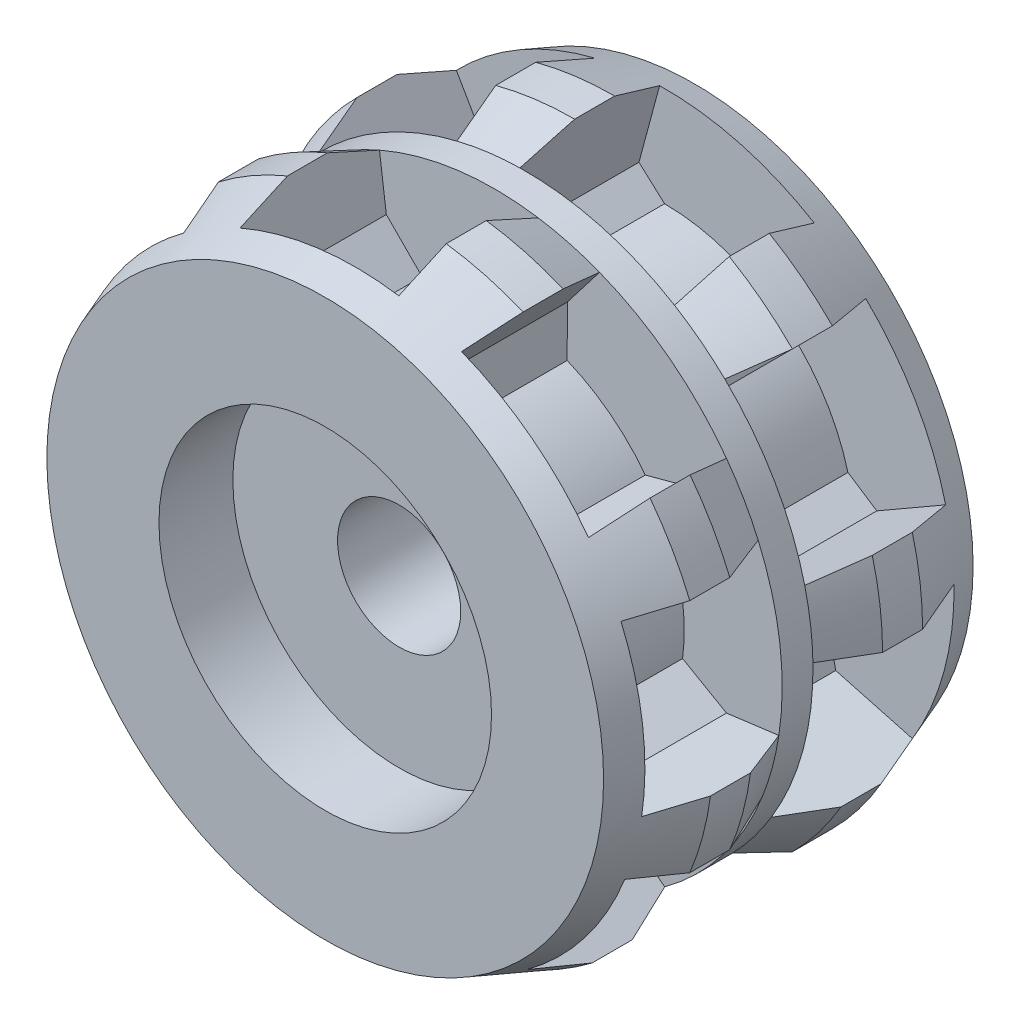
from build123d import *
from OCP.BRepFilletAPI import BRepFilletAPI_MakeChamfer

# Parameters (mm, degrees)
SKETCH1_R       = 23.35
EXTRUDE1_DEPTH  = 2.5
EXTRUDE2_REACH  = 92.111
SKETCH2_R       = 5
SKETCH3_R       = 25
SKETCH3_R_2     = 5
EXTRUDE3_DEPTH  = 13.75
EXTRUDE4_START  = 13.75
SKETCH4_R       = 25
SKETCH4_R_2     = 5
EXTRUDE4_DEPTH  = 13.75
CHAMFER1_SIZE   = 1.65
CHAMFER1_SIZE_2 = 4
CHAMFER2_SIZE   = 6.5
CHAMFER2_SIZE2  = 2.4
EXTRUDE5_DEPTH  = 11.3
EXTRUDE6_START  = 11.3
EXTRUDE6_DEPTH  = 11.3
SKETCH9_R       = 13.5
SKETCH9_R_2     = 9.75
EXTRUDE7_DEPTH  = 6
EXTRUDE8_START  = -6
SKETCH10_R      = 13.5
SKETCH10_R_2    = 9.75
EXTRUDE8_DEPTH  = 6
SKETCH11_R      = 9.75
EXTRUDE9_DEPTH  = 6


with BuildPart() as part:
    # Sketch1 → Extrude1 (new body)
    with BuildSketch(Plane.XY):
        with Locations((-57.424544578, 16.515488854)):
            Circle(SKETCH1_R)
    extrude(amount=EXTRUDE1_DEPTH)

    # Sketch2 → Extrude2 (cut, up to next)
    with BuildSketch(Plane.XY.offset(2.5), mode=Mode.PRIVATE) as extrude2_sk1:
        with Locations((-57.424544578, 16.515488854)):
            Circle(SKETCH2_R)
    extrude2_tool1 = extrude(extrude2_sk1.sketch, amount=-EXTRUDE2_REACH, mode=Mode.PRIVATE) & part.part
    add(extrude2_tool1.solids().sort_by_distance((-57.424545, 16.515489, 2.5))[0], mode=Mode.SUBTRACT)

    # Sketch3 → Extrude3 (add)
    with BuildSketch(Plane(origin=(0, 0, 0), x_dir=(-1, 0, 0), z_dir=(0, 0, -1))):
        with Locations((57.424544578, 16.515488854)):
            Circle(SKETCH3_R)
        with Locations(Location((57.424544578, 16.515488854, 0), (0, 0, 180))):
            Circle(SKETCH3_R_2, mode=Mode.SUBTRACT)
    extrude(amount=EXTRUDE3_DEPTH)

    # Sketch4 → Extrude4 (add)
    with BuildSketch(Plane.XY.offset(2.5).offset(EXTRUDE4_START)):
        with Locations(Location((-57.424544578, 16.515488854, 0), (0, 0, 180))):
            Circle(SKETCH4_R)
        with Locations((-57.424544578, 16.515488854)):
            Circle(SKETCH4_R_2, mode=Mode.SUBTRACT)
    extrude(amount=-EXTRUDE4_DEPTH)

    # Chamfer1
    chamfer1_edges_1 = [part.edges().sort_by_distance(p)[0] for p in [
        (-32.424544578, 16.515488854, 0),
    ]]
    chamfer1_side_1 = [part.faces().sort_by_distance(p)[0] for p in [
        (-32.457544578, 16.515488854, 0),
    ]]
    chamfer1_edges_2 = [part.edges().sort_by_distance(p)[0] for p in [
        (-32.424544578, 16.515488854, 2.5),
    ]]
    chamfer1_side_2 = [part.faces().sort_by_distance(p)[0] for p in [
        (-32.457544578, 16.515488854, 2.5),
    ]]
    chamfer1 = BRepFilletAPI_MakeChamfer(part.part.solid().wrapped)
    for e in chamfer1_edges_1:
        chamfer1.Add(CHAMFER1_SIZE - 0.0001, CHAMFER1_SIZE_2 - 0.0001, e.wrapped, chamfer1_side_1[0].wrapped)
    for e in chamfer1_edges_2:
        chamfer1.Add(CHAMFER1_SIZE - 0.0001, CHAMFER1_SIZE_2 - 0.0001, e.wrapped, chamfer1_side_2[0].wrapped)
    add(Compound.cast(chamfer1.Shape()), mode=Mode.REPLACE)  # a hair under: the kernel refuses the full size

    # Chamfer2: one chamfer whose edges measure the first distance from different faces: ONE call of the kernel's chamfer builder (chamfer() names one face for all edges)
    chamfer2_edges_1 = [part.edges().sort_by_distance(p)[0] for p in [
        (-32.424544578, 16.515488854, 16.25),
    ]]
    chamfer2_side_1 = [part.faces().sort_by_distance(p)[0] for p in [
        (-32.424544578, 16.515488854, 11.37495),
    ]]
    chamfer2_edges_2 = [part.edges().sort_by_distance(p)[0] for p in [
        (-32.424544578, 16.515488854, -13.75),
    ]]
    chamfer2_side_2 = [part.faces().sort_by_distance(p)[0] for p in [
        (-32.424544578, 16.515488854, -8.87495),
    ]]
    chamfer2 = BRepFilletAPI_MakeChamfer(part.part.solid().wrapped)
    for e in chamfer2_edges_1:
        chamfer2.Add(CHAMFER2_SIZE, CHAMFER2_SIZE2, e.wrapped, chamfer2_side_1[0].wrapped)  # the first distance lies on this face
    for e in chamfer2_edges_2:
        chamfer2.Add(CHAMFER2_SIZE, CHAMFER2_SIZE2, e.wrapped, chamfer2_side_2[0].wrapped)  # the first distance lies on this face
    add(Compound.cast(chamfer2.Shape()), mode=Mode.REPLACE)

    # Sketch5 → Extrude5 (cut)
    with BuildSketch(Plane.XY):
        with BuildLine():
            Line((-57.424544578, 41.515488854), (-59.504544578, 33.790619923))
            Line((-59.504544578, 33.790619923), (-57.424544578, 31.915488854))
            ThreePointArc((-57.424544578, 31.915488854), (-53.420544578, 31.385861546), (-49.691950778, 29.833408854))
            Line((-49.691950778, 29.833408854), (-46.951632565, 30.410619923))
            Line((-46.951632565, 30.410619923), (-44.871632565, 38.135488854))
            ThreePointArc((-44.871632565, 38.135488854), (-50.924544578, 40.655704263), (-57.424544578, 41.515488854))
        make_face()
        with BuildLine():
            Line((-39.746875048, 34.193158383), (-46.679964358, 30.201633283))
            Line((-46.679964358, 30.201633283), (-46.535100147, 27.404933284))
            ThreePointArc((-46.535100147, 27.404933284), (-44.078347656, 24.199174671), (-42.539583522, 20.464910885))
            Line((-42.539583522, 20.464910885), (-40.19373607, 18.935363155))
            Line((-40.19373607, 18.935363155), (-33.26064676, 22.926888255))
            ThreePointArc((-33.26064676, 22.926888255), (-35.758640485, 28.989004791), (-39.746875048, 34.193158383))
        make_face()
        with BuildLine():
            Line((-32.424544578, 16.515488854), (-40.149413508, 18.595488854))
            Line((-40.149413508, 18.595488854), (-42.024544578, 16.515488854))
            ThreePointArc((-42.024544578, 16.515488854), (-42.554171885, 12.511488854), (-44.106624578, 8.782895054))
            Line((-44.106624578, 8.782895054), (-43.529413508, 6.042576841))
            Line((-43.529413508, 6.042576841), (-35.804544578, 3.962576841))
            ThreePointArc((-35.804544578, 3.962576841), (-33.284329168, 10.015488854), (-32.424544578, 16.515488854))
        make_face()
        with BuildLine():
            Line((-39.746875048, -1.162180676), (-43.738400148, 5.770908634))
            Line((-43.738400148, 5.770908634), (-46.535100147, 5.626044423))
            ThreePointArc((-46.535100147, 5.626044423), (-49.74085876, 3.169291933), (-53.475122546, 1.630527798))
            Line((-53.475122546, 1.630527798), (-55.004670276, -0.715319654))
            Line((-55.004670276, -0.715319654), (-51.013145176, -7.648408963))
            ThreePointArc((-51.013145176, -7.648408963), (-44.95102864, -5.150415239), (-39.746875048, -1.162180676))
        make_face()
        with BuildLine():
            Line((-57.424544578, -8.484511146), (-55.344544578, -0.759642215))
            Line((-55.344544578, -0.759642215), (-57.424544578, 1.115488854))
            ThreePointArc((-57.424544578, 1.115488854), (-61.428544578, 1.645116162), (-65.157138377, 3.197568854))
            Line((-65.157138377, 3.197568854), (-67.89745659, 2.620357785))
            Line((-67.89745659, 2.620357785), (-69.97745659, -5.104511146))
            ThreePointArc((-69.97745659, -5.104511146), (-63.924544578, -7.624726555), (-57.424544578, -8.484511146))
        make_face()
        with BuildLine():
            Line((-75.102214107, -1.162180676), (-68.169124797, 2.829344424))
            Line((-68.169124797, 2.829344424), (-68.313989008, 5.626044423))
            ThreePointArc((-68.313989008, 5.626044423), (-70.770741499, 8.831803036), (-72.309505633, 12.566066822))
            Line((-72.309505633, 12.566066822), (-74.655353085, 14.095614552))
            Line((-74.655353085, 14.095614552), (-81.588442395, 10.104089452))
            ThreePointArc((-81.588442395, 10.104089452), (-79.09044867, 4.041972916), (-75.102214107, -1.162180676))
        make_face()
        with BuildLine():
            Line((-82.424544578, 16.515488854), (-74.699675647, 14.435488854))
            Line((-74.699675647, 14.435488854), (-72.824544578, 16.515488854))
            ThreePointArc((-72.824544578, 16.515488854), (-72.29491727, 20.519488854), (-70.742464578, 24.248082654))
            Line((-70.742464578, 24.248082654), (-71.319675647, 26.988400866))
            Line((-71.319675647, 26.988400866), (-79.044544578, 29.068400866))
            ThreePointArc((-79.044544578, 29.068400866), (-81.564759987, 23.015488854), (-82.424544578, 16.515488854))
        make_face()
        with BuildLine():
            Line((-75.102214107, 34.193158383), (-71.110689007, 27.260069074))
            Line((-71.110689007, 27.260069074), (-68.313989008, 27.404933284))
            ThreePointArc((-68.313989008, 27.404933284), (-65.108230395, 29.861685775), (-61.373966609, 31.400449909))
            Line((-61.373966609, 31.400449909), (-59.844418879, 33.746297361))
            Line((-59.844418879, 33.746297361), (-63.835943979, 40.679386671))
            ThreePointArc((-63.835943979, 40.679386671), (-69.898060515, 38.181392947), (-75.102214107, 34.193158383))
        make_face()
    extrude(amount=-EXTRUDE5_DEPTH, mode=Mode.SUBTRACT)

    # Sketch7 → Extrude6 (cut)
    with BuildSketch(Plane.XY.offset(2.5).offset(EXTRUDE6_START)):
        with BuildLine():
            Line((-47.857458768, 39.612477166), (-51.515845357, 34.856827099))
            Line((-51.515845357, 34.856827099), (-51.531219719, 30.743233654))
            ThreePointArc((-51.531219719, 30.743233654), (-48.034685667, 28.721657361), (-45.184012095, 25.860507021))
            Line((-45.184012095, 25.860507021), (-41.211936876, 26.930322823))
            Line((-41.211936876, 26.930322823), (-37.553550288, 31.685972891))
            ThreePointArc((-37.553550288, 31.685972891), (-42.181267125, 36.33069747), (-47.857458768, 39.612477166))
        make_face()
        with BuildLine():
            Line((-34.327556265, 26.082574663), (-40.277178642, 25.306692216))
            Line((-40.277178642, 25.306692216), (-43.196799777, 22.408813712))
            ThreePointArc((-43.196799777, 22.408813712), (-42.153847143, 18.506920468), (-42.161255337, 14.468051046))
            Line((-42.161255337, 14.468051046), (-38.596100006, 12.415843732))
            Line((-38.596100006, 12.415843732), (-32.646477629, 13.191726179))
            ThreePointArc((-32.646477629, 13.191726179), (-32.63445134, 19.748332383), (-34.327556265, 26.082574663))
        make_face()
        with BuildLine():
            Line((-34.327556265, 6.948403045), (-39.083206333, 10.606789633))
            Line((-39.083206333, 10.606789633), (-43.196799777, 10.622163995))
            ThreePointArc((-43.196799777, 10.622163995), (-45.21837607, 7.125629943), (-48.07952641, 4.274956371))
            Line((-48.07952641, 4.274956371), (-47.009710608, 0.302881152))
            Line((-47.009710608, 0.302881152), (-42.25406054, -3.355505436))
            ThreePointArc((-42.25406054, -3.355505436), (-37.609335961, 1.272211402), (-34.327556265, 6.948403045))
        make_face()
        with BuildLine():
            Line((-47.857458768, -6.581499459), (-48.633341215, -0.631877082))
            Line((-48.633341215, -0.631877082), (-51.531219719, 2.287744053))
            ThreePointArc((-51.531219719, 2.287744053), (-55.433112963, 1.24479142), (-59.471982385, 1.252199614))
            Line((-59.471982385, 1.252199614), (-61.524189699, -2.312955717))
            Line((-61.524189699, -2.312955717), (-60.748307252, -8.262578094))
            ThreePointArc((-60.748307252, -8.262578094), (-54.191701048, -8.274604384), (-47.857458768, -6.581499459))
        make_face()
        with BuildLine():
            Line((-66.991630387, -6.581499459), (-63.333243798, -1.825849391))
            Line((-63.333243798, -1.825849391), (-63.317869436, 2.287744053))
            ThreePointArc((-63.317869436, 2.287744053), (-66.814403488, 4.309320346), (-69.66507706, 7.170470686))
            Line((-69.66507706, 7.170470686), (-73.637152279, 6.100654884))
            Line((-73.637152279, 6.100654884), (-77.295538867, 1.345004816))
            ThreePointArc((-77.295538867, 1.345004816), (-72.66782203, -3.299719763), (-66.991630387, -6.581499459))
        make_face()
        with BuildLine():
            Line((-80.52153289, 6.948403045), (-74.571910513, 7.724285492))
            Line((-74.571910513, 7.724285492), (-71.652289378, 10.622163995))
            ThreePointArc((-71.652289378, 10.622163995), (-72.695242012, 14.52405724), (-72.687833818, 18.562926661))
            Line((-72.687833818, 18.562926661), (-76.252989149, 20.615133975))
            Line((-76.252989149, 20.615133975), (-82.202611526, 19.839251528))
            ThreePointArc((-82.202611526, 19.839251528), (-82.214637815, 13.282645324), (-80.52153289, 6.948403045))
        make_face()
        with BuildLine():
            Line((-80.52153289, 26.082574663), (-75.765882822, 22.424188074))
            Line((-75.765882822, 22.424188074), (-71.652289378, 22.408813712))
            ThreePointArc((-71.652289378, 22.408813712), (-69.630713085, 25.905347764), (-66.769562745, 28.756021336))
            Line((-66.769562745, 28.756021336), (-67.839378547, 32.728096555))
            Line((-67.839378547, 32.728096555), (-72.595028615, 36.386483143))
            ThreePointArc((-72.595028615, 36.386483143), (-77.239753194, 31.758766306), (-80.52153289, 26.082574663))
        make_face()
        with BuildLine():
            Line((-66.991630387, 39.612477166), (-66.21574794, 33.66285479))
            Line((-66.21574794, 33.66285479), (-63.317869436, 30.743233654))
            ThreePointArc((-63.317869436, 30.743233654), (-59.415976192, 31.786186288), (-55.37710677, 31.778778094))
            Line((-55.37710677, 31.778778094), (-53.324899456, 35.343933425))
            Line((-53.324899456, 35.343933425), (-54.100781903, 41.293555802))
            ThreePointArc((-54.100781903, 41.293555802), (-60.657388107, 41.305582091), (-66.991630387, 39.612477166))
        make_face()
    extrude(amount=-EXTRUDE6_DEPTH, mode=Mode.SUBTRACT)

    # Sketch9 → Extrude7 (cut)
    with BuildSketch(Plane.XY.offset(16.25)):
        with Locations((-57.424544578, 16.515488854)):
            Circle(SKETCH9_R)
        with Locations((-57.424544578, 16.515488854)):
            Circle(SKETCH9_R_2, mode=Mode.SUBTRACT)
    extrude(amount=-EXTRUDE7_DEPTH, mode=Mode.SUBTRACT)

    # Sketch10 → Extrude8 (cut)
    with BuildSketch(Plane(origin=(0, 0, -13.75), x_dir=(-1, 0, 0), z_dir=(0, 0, -1)).offset(EXTRUDE8_START)):
        with Locations(Location((57.424544578, 16.515488854, 0), (0, 0, 180))):
            Circle(SKETCH10_R)
        with Locations(Location((57.424544578, 16.515488854, 0), (0, 0, 180))):
            Circle(SKETCH10_R_2, mode=Mode.SUBTRACT)
    extrude(amount=EXTRUDE8_DEPTH, mode=Mode.SUBTRACT)

    # Sketch11 → Extrude9 (cut)
    with BuildSketch(Plane.XY.offset(16.25)):
        with Locations(Location((-57.424544578, 16.515488854, 0), (0, 0, 180))):
            Circle(SKETCH11_R)
    extrude(amount=-EXTRUDE9_DEPTH, mode=Mode.SUBTRACT)


solid = part.part
